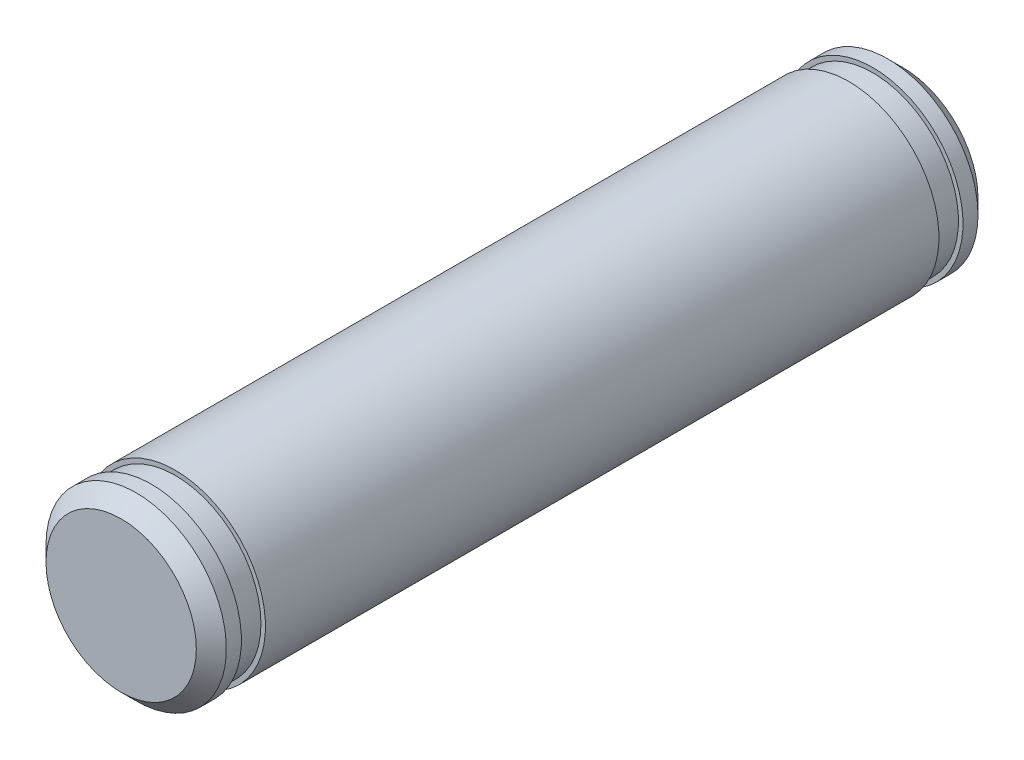
from build123d import *

# Parameters (mm, degrees)
SZKIC1_R                    = 3
DODANIE_WYCI_GNI_CIE1_DEPTH = 26
SFAZOWANIE1_SIZE            = 0.5
WYTNIJ_WYCI_GNI_CIE1_START  = -1.8
SZKIC2_R                    = 3
SZKIC2_R_2                  = 2.85
WYTNIJ_WYCI_GNI_CIE1_DEPTH  = 0.8
WYTNIJ_WYCI_GNI_CIE2_START  = -1
SZKIC3_R                    = 3
SZKIC3_R_2                  = 2.85
WYTNIJ_WYCI_GNI_CIE2_DEPTH  = 0.8


with BuildPart() as part:
    # Szkic1 → Dodanie-wyciągnięcie1 (new body)
    with BuildSketch(Plane.XY):
        Circle(SZKIC1_R)
    extrude(amount=DODANIE_WYCI_GNI_CIE1_DEPTH)

    # Sfazowanie1
    sfazowanie1_edges = [part.edges().sort_by_distance(p)[0] for p in [
        (-3, 0, 0),
        (-3, 0, 26),
    ]]
    chamfer(sfazowanie1_edges, length=SFAZOWANIE1_SIZE)

    # Szkic2 → Wytnij-wyciągnięcie1 (cut)
    with BuildSketch(Plane.XY.offset(26).offset(WYTNIJ_WYCI_GNI_CIE1_START)):
        Circle(SZKIC2_R)
        Circle(SZKIC2_R_2, mode=Mode.SUBTRACT)
    extrude(amount=WYTNIJ_WYCI_GNI_CIE1_DEPTH, mode=Mode.SUBTRACT)

    # Szkic3 → Wytnij-wyciągnięcie2 (cut)
    with BuildSketch(Plane(origin=(0, 0, 0), x_dir=(-1, 0, 0), z_dir=(0, 0, -1)).offset(WYTNIJ_WYCI_GNI_CIE2_START)):
        Circle(SZKIC3_R)
        Circle(SZKIC3_R_2, mode=Mode.SUBTRACT)
    extrude(amount=-WYTNIJ_WYCI_GNI_CIE2_DEPTH, mode=Mode.SUBTRACT)


solid = part.part
